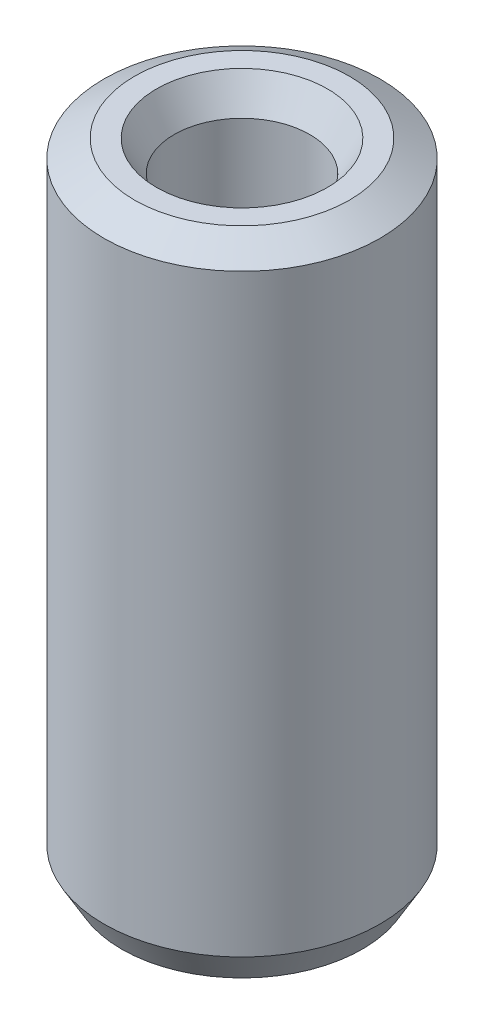
from build123d import *
from OCP.BRepFilletAPI import BRepFilletAPI_MakeChamfer

# Parameters (mm, degrees)
SKETCH1_R           = 30
BOSS_EXTRUDE1_DEPTH = 139.543938747
SKETCH2_R           = 14.725187662
CUT_EXTRUDE1_DEPTH  = 146.850988482
CHAMFER1_SIZE       = 3.847116061
CHAMFER1_SIZE2      = 6.66340048


with BuildPart() as part:
    # Sketch1 → Boss-Extrude1 (new body)
    with BuildSketch(Plane(origin=(0, 0, 0), x_dir=(1, 0, 0), z_dir=(0, 1, 0))):
        Circle(SKETCH1_R)
    extrude(amount=BOSS_EXTRUDE1_DEPTH)

    # Sketch2 → Cut-Extrude1 (cut, through all)
    with BuildSketch(Plane(origin=(0, 0, 0), x_dir=(1, 0, 0), z_dir=(0, 1, 0))):
        Circle(SKETCH2_R)
    extrude(amount=CUT_EXTRUDE1_DEPTH, mode=Mode.SUBTRACT)

    # Chamfer1: one chamfer whose edges measure the first distance from different faces: ONE call of the kernel's chamfer builder (chamfer() names one face for all edges)
    chamfer1_edges_1 = [part.edges().sort_by_distance(p)[0] for p in [
        (-14.725187662, 139.543938747, 0),
    ]]
    chamfer1_side_1 = [part.faces().sort_by_distance(p)[0] for p in [
        (-29.151471863, 139.543938747, 0),
    ]]
    chamfer1_edges_2 = [part.edges().sort_by_distance(p)[0] for p in [
        (-14.725187662, 0, 0),
    ]]
    chamfer1_side_2 = [part.faces().sort_by_distance(p)[0] for p in [
        (-14.725187662, 69.771969374, 0),
    ]]
    chamfer1_edges_3 = [part.edges().sort_by_distance(p)[0] for p in [
        (-30, 0, 0),
    ]]
    chamfer1_side_3 = [part.faces().sort_by_distance(p)[0] for p in [
        (-29.151471863, 0, 0),
    ]]
    chamfer1_edges_4 = [part.edges().sort_by_distance(p)[0] for p in [
        (-30, 139.543938747, 0),
    ]]
    chamfer1_side_4 = [part.faces().sort_by_distance(p)[0] for p in [
        (-30, 69.771969374, 0),
    ]]
    chamfer1 = BRepFilletAPI_MakeChamfer(part.part.solid().wrapped)
    for e in chamfer1_edges_1:
        chamfer1.Add(CHAMFER1_SIZE, CHAMFER1_SIZE2, e.wrapped, chamfer1_side_1[0].wrapped)  # the first distance lies on this face
    for e in chamfer1_edges_2:
        chamfer1.Add(CHAMFER1_SIZE, CHAMFER1_SIZE2, e.wrapped, chamfer1_side_2[0].wrapped)  # the first distance lies on this face
    for e in chamfer1_edges_3:
        chamfer1.Add(CHAMFER1_SIZE, CHAMFER1_SIZE2, e.wrapped, chamfer1_side_3[0].wrapped)  # the first distance lies on this face
    for e in chamfer1_edges_4:
        chamfer1.Add(CHAMFER1_SIZE, CHAMFER1_SIZE2, e.wrapped, chamfer1_side_4[0].wrapped)  # the first distance lies on this face
    add(Compound.cast(chamfer1.Shape()), mode=Mode.REPLACE)


solid = part.part
